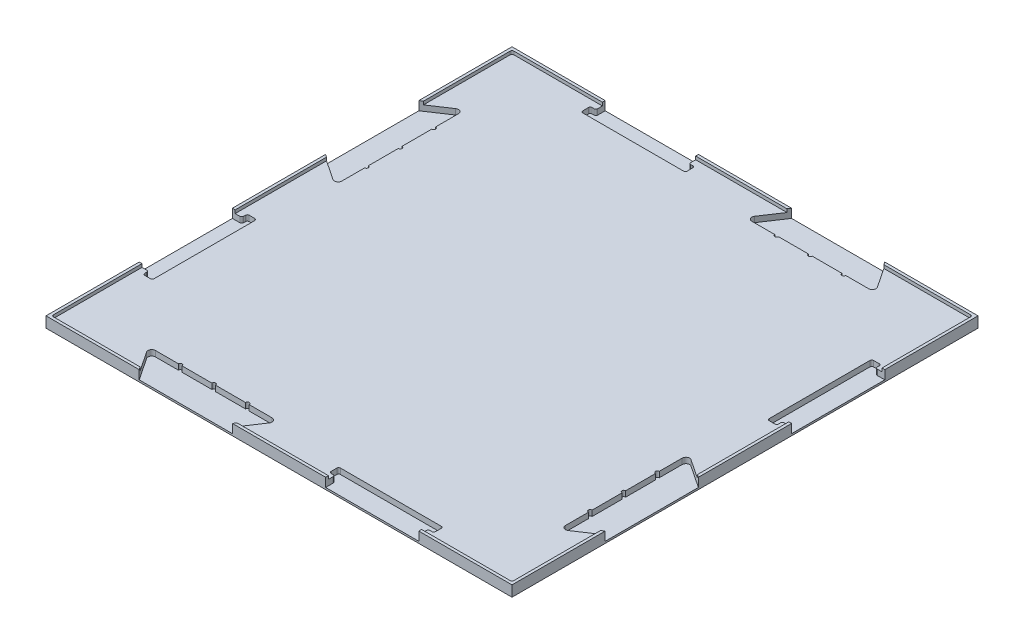
from build123d import *

# Parameters (mm, degrees)
SKETCH1_W           = 250
SKETCH1_H           = 250
BOSS_EXTRUDE1_DEPTH = 2.875
SKETCH2_W           = 247
SKETCH2_H           = 247
CUT_EXTRUDE1_DEPTH  = 1.75
CUT_EXTRUDE2_START  = -4.75
CUT_EXTRUDE2_DEPTH  = 182.620185447
CUT_EXTRUDE4_DEPTH  = 3
CUT_EXTRUDE3_START  = -4.75
CUT_EXTRUDE3_DEPTH  = 182.620185447
FILLET2_R           = 1
FILLET3_R           = 2
CIRPATTERN1_START   = -1.875
CIRPATTERN1_DEPTH   = 4.75


# Read off the part's stored shape, not the designer's step: CirPattern1
with BuildPart() as part:
    # Sketch1 → Boss-Extrude1 (new, symmetric)
    with BuildSketch(Plane(origin=(0, 0, 0), x_dir=(1, 0, 0), z_dir=(0, 1, 0))):
        Rectangle(SKETCH1_W, SKETCH1_H)
    extrude(amount=BOSS_EXTRUDE1_DEPTH, both=True)

    # Sketch2 → Cut-Extrude1 (cut)
    with BuildSketch(Plane(origin=(0, 2.875, 0), x_dir=(1, 0, 0), z_dir=(0, 1, 0))):
        Rectangle(SKETCH2_W, SKETCH2_H)
    extrude(amount=-CUT_EXTRUDE1_DEPTH, mode=Mode.SUBTRACT)

    # Sketch4 → Cut-Extrude2 (cut)
    with BuildSketch(Plane(origin=(0, 2.875, 0), x_dir=(1, 0, 0), z_dir=(0, 1, 0)).offset(CUT_EXTRUDE2_START)):
        Polygon((-75, -125), (-85, -110), (-15, -110), (-25, -125), align=None)
    extrude(amount=CUT_EXTRUDE2_DEPTH, mode=Mode.SUBTRACT)

    # Sketch6 → Cut-Extrude4 (cut)
    with BuildSketch(Plane(origin=(0, 1.125, 0), x_dir=(1, 0, 0), z_dir=(0, 1, 0))):
        with BuildLine():
            Line((-69, -110), (-67, -110))
            ThreePointArc((-67, -110), (-68, -109), (-69, -110))
        make_face()
        with BuildLine():
            Line((-51, -110), (-49, -110))
            ThreePointArc((-49, -110), (-50, -109), (-51, -110))
        make_face()
        with BuildLine():
            Line((-33, -110), (-31, -110))
            ThreePointArc((-31, -110), (-32, -109), (-33, -110))
        make_face()
    extrude(amount=-CUT_EXTRUDE4_DEPTH, mode=Mode.SUBTRACT)

    # Sketch5 → Cut-Extrude3 (cut)
    with BuildSketch(Plane(origin=(0, 2.875, 0), x_dir=(1, 0, 0), z_dir=(0, 1, 0)).offset(CUT_EXTRUDE3_START)):
        Polygon((25, -125), (25, -120), (22, -120), (22, -115), (78, -115), (78, -120), (75, -120), (75, -125), align=None)
    extrude(amount=CUT_EXTRUDE3_DEPTH, mode=Mode.SUBTRACT)

    # Fillet2
    fillet2_edges = [part.edges().sort_by_distance(p)[0] for p in [
        (-123.5, 2, -123.5),
        (-123.5, 2, 123.5),
        (123.5, 2, 123.5),
        (123.5, 2, -123.5),
        (75, -0.375, 120),
        (78, -0.375, 120),
        (78, -0.375, 115),
        (22, -0.375, 115),
        (22, -0.375, 120),
        (25, -0.375, 120),
    ]]
    fillet(fillet2_edges, radius=FILLET2_R)

    # Fillet3
    fillet3_edges = [part.edges().sort_by_distance(p)[0] for p in [
        (-85, -0.375, 110),
        (-15, -0.375, 110),
    ]]
    fillet(fillet3_edges, radius=FILLET3_R)

    # CirPattern1 outline → CirPattern1 (cut)
    with BuildSketch(Plane(origin=(0, 0, 0), x_dir=(1, 0, 0), z_dir=(0, 1, 0)).offset(CIRPATTERN1_START)):
        with BuildLine():
            ThreePointArc((110, -31), (109, -32), (110, -33))
            Line((110, -33), (110, -49))
            ThreePointArc((110, -49), (109, -50), (110, -51))
            Line((110, -51), (110, -67))
            ThreePointArc((110, -67), (109, -68), (110, -69))
            Line((110, -69), (110, -81.262965816))
            ThreePointArc((110, -81.262965816), (111.056284149, -83.026315014), (113.109400392, -82.927066405))
            Line((113.109400392, -82.927066405), (125, -75))
            Line((125, -75), (125, -25))
            Line((125, -25), (113.109400392, -17.072933595))
            ThreePointArc((113.109400392, -17.072933595), (111.056284149, -16.973684986), (110, -18.737034184))
            Line((110, -18.737034184), (110, -31))
        make_face()
        with BuildLine():
            Line((-125, 75), (-125, 25))
            Line((-125, 25), (-113.109400392, 17.072933595))
            ThreePointArc((-113.109400392, 17.072933595), (-111.056284149, 16.973684986), (-110, 18.737034184))
            Line((-110, 18.737034184), (-110, 31))
            ThreePointArc((-110, 31), (-109, 32), (-110, 33))
            Line((-110, 33), (-110, 49))
            ThreePointArc((-110, 49), (-109, 50), (-110, 51))
            Line((-110, 51), (-110, 67))
            ThreePointArc((-110, 67), (-109, 68), (-110, 69))
            Line((-110, 69), (-110, 81.262965816))
            ThreePointArc((-110, 81.262965816), (-111.056284149, 83.026315014), (-113.109400392, 82.927066405))
            Line((-113.109400392, 82.927066405), (-125, 75))
        make_face()
        with BuildLine():
            Line((75, 125), (25, 125))
            Line((25, 125), (17.072933595, 113.109400392))
            ThreePointArc((17.072933595, 113.109400392), (16.973684986, 111.056284149), (18.737034184, 110))
            Line((18.737034184, 110), (31, 110))
            ThreePointArc((31, 110), (32, 109), (33, 110))
            Line((33, 110), (49, 110))
            ThreePointArc((49, 110), (50, 109), (51, 110))
            Line((51, 110), (67, 110))
            ThreePointArc((67, 110), (68, 109), (69, 110))
            Line((69, 110), (81.262965816, 110))
            ThreePointArc((81.262965816, 110), (83.026315014, 111.056284149), (82.927066405, 113.109400392))
            Line((82.927066405, 113.109400392), (75, 125))
        make_face()
        with BuildLine():
            Line((125, 75), (121, 75))
            ThreePointArc((121, 75), (120.292893219, 75.292893219), (120, 76))
            Line((120, 76), (120, 77))
            ThreePointArc((120, 77), (119.707106781, 77.707106781), (119, 78))
            Line((119, 78), (116, 78))
            ThreePointArc((116, 78), (115.292893219, 77.707106781), (115, 77))
            Line((115, 77), (115, 23))
            ThreePointArc((115, 23), (115.292893219, 22.292893219), (116, 22))
            Line((116, 22), (119, 22))
            ThreePointArc((119, 22), (119.707106781, 22.292893219), (120, 23))
            Line((120, 23), (120, 24))
            ThreePointArc((120, 24), (120.292893219, 24.707106781), (121, 25))
            Line((121, 25), (125, 25))
            Line((125, 25), (125, 75))
        make_face()
        with BuildLine():
            Line((-25, 125), (-75, 125))
            Line((-75, 125), (-75, 121))
            ThreePointArc((-75, 121), (-75.292893219, 120.292893219), (-76, 120))
            Line((-76, 120), (-77, 120))
            ThreePointArc((-77, 120), (-77.707106781, 119.707106781), (-78, 119))
            Line((-78, 119), (-78, 116))
            ThreePointArc((-78, 116), (-77.707106781, 115.292893219), (-77, 115))
            Line((-77, 115), (-23, 115))
            ThreePointArc((-23, 115), (-22.292893219, 115.292893219), (-22, 116))
            Line((-22, 116), (-22, 119))
            ThreePointArc((-22, 119), (-22.292893219, 119.707106781), (-23, 120))
            Line((-23, 120), (-24, 120))
            ThreePointArc((-24, 120), (-24.707106781, 120.292893219), (-25, 121))
            Line((-25, 121), (-25, 125))
        make_face()
        with BuildLine():
            Line((-125, -25), (-125, -75))
            Line((-125, -75), (-121, -75))
            ThreePointArc((-121, -75), (-120.292893219, -75.292893219), (-120, -76))
            Line((-120, -76), (-120, -77))
            ThreePointArc((-120, -77), (-119.707106781, -77.707106781), (-119, -78))
            Line((-119, -78), (-116, -78))
            ThreePointArc((-116, -78), (-115.292893219, -77.707106781), (-115, -77))
            Line((-115, -77), (-115, -23))
            ThreePointArc((-115, -23), (-115.292893219, -22.292893219), (-116, -22))
            Line((-116, -22), (-119, -22))
            ThreePointArc((-119, -22), (-119.707106781, -22.292893219), (-120, -23))
            Line((-120, -23), (-120, -24))
            ThreePointArc((-120, -24), (-120.292893219, -24.707106781), (-121, -25))
            Line((-121, -25), (-125, -25))
        make_face()
    extrude(amount=CIRPATTERN1_DEPTH, mode=Mode.SUBTRACT)


solid = part.part
